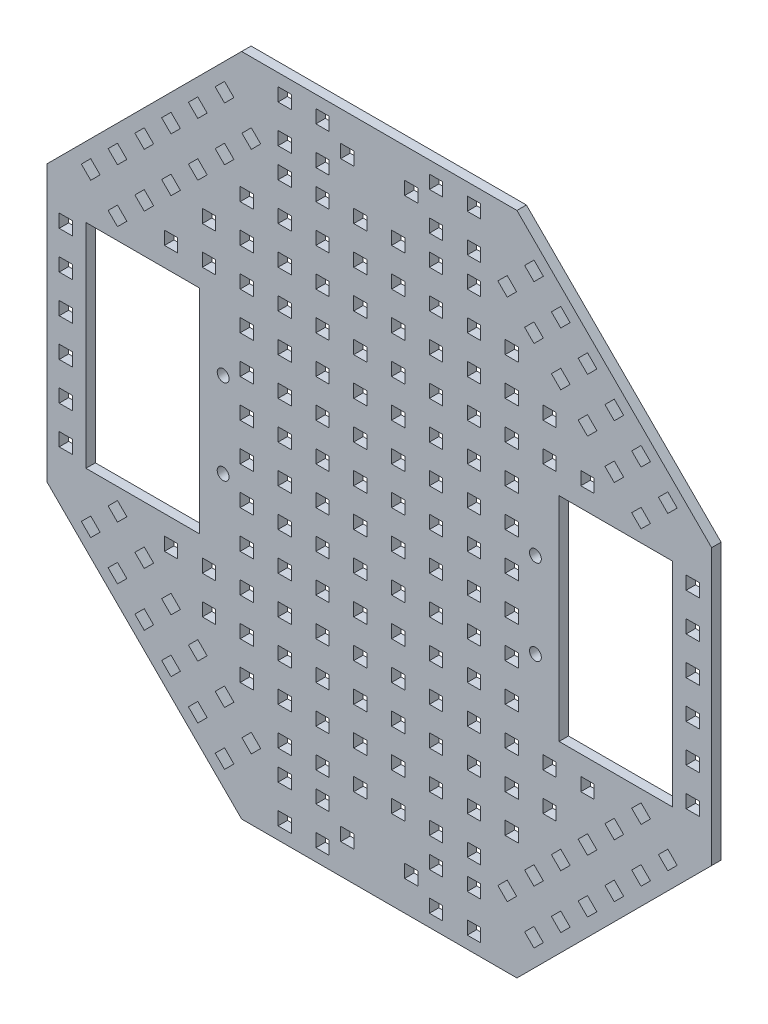
from build123d import *

# Parameters (mm, degrees)
ESBO_O4_R                = 1.249999059
ESBO_O4_R_2              = 1.250001584
ESBO_O4_W                = 2.8
ESBO_O4_H                = 2.8
RESSALTO_EXTRUS_O1_DEPTH = 2
ESBO_O5_W                = 2.8
ESBO_O5_H                = 2.8
CORTE_EXTRUS_O1_DEPTH    = 100.364031547


with BuildPart() as part:
    # Esboço4 → Ressalto-extrusão1 (new body)
    with BuildSketch(Plane.XY):
        Polygon((29.09715508, 70.246746421), (-29.09715508, 70.246746421), (-70.246746421, 29.09715508), (-70.246746421, -29.09715508), (-29.09715508, -70.246746421), (29.09715508, -70.246746421), (70.246746421, -29.09715508), (70.246746421, 29.09715508), align=None)
        with Locations((-32.999995927, 8.999995245)):
            Circle(ESBO_O4_R, mode=Mode.SUBTRACT)
        with Locations((-32.999995927, -9.000003853)):
            Circle(ESBO_O4_R_2, mode=Mode.SUBTRACT)
        with Locations((32.999995927, -9.000003853)):
            Circle(ESBO_O4_R_2, mode=Mode.SUBTRACT)
        with Locations((32.999995927, 8.999995245)):
            Circle(ESBO_O4_R, mode=Mode.SUBTRACT)
        Polygon((-37.99999547, 0), (-37.99999547, 22.5), (-61.99999547, 22.5), (-61.99999547, -22.5), (-37.99999547, -22.5), align=None, mode=Mode.SUBTRACT)
        with Locations((-6.749998331, -62.499996189)):
            Rectangle(ESBO_O4_W, ESBO_O4_H, mode=Mode.SUBTRACT)
        with Locations((-6.749998331, 62.499996189)):
            Rectangle(ESBO_O4_W, ESBO_O4_H, mode=Mode.SUBTRACT)
        with Locations((6.749998331, -62.499996189)):
            Rectangle(ESBO_O4_W, ESBO_O4_H, mode=Mode.SUBTRACT)
        with Locations((6.749998331, 62.499996189)):
            Rectangle(ESBO_O4_W, ESBO_O4_H, mode=Mode.SUBTRACT)
        Polygon((37.99999547, -22.5), (37.99999547, 0), (37.99999547, 22.5), (61.99999547, 22.5), (61.99999547, -22.5), align=None, mode=Mode.SUBTRACT)
    extrude(amount=RESSALTO_EXTRUS_O1_DEPTH)

    # Esboço5 → Corte-extrusão1 (cut, through all)
    with BuildSketch(Plane(origin=(0, 0, 0), x_dir=(-1, 0, 0), z_dir=(0, 0, -1))):
        with Locations((-12, -4)):
            Rectangle(ESBO_O5_W, ESBO_O5_H)
        with Locations((-4, -4)):
            Rectangle(ESBO_O5_W, ESBO_O5_H)
        with Locations((-20, -4)):
            Rectangle(ESBO_O5_W, ESBO_O5_H)
        with Locations((-28, -4)):
            Rectangle(ESBO_O5_W, ESBO_O5_H)
        with Locations((-12, -12)):
            Rectangle(ESBO_O5_W, ESBO_O5_H)
        with Locations((-20, -12)):
            Rectangle(ESBO_O5_W, ESBO_O5_H)
        with Locations((-28, -12)):
            Rectangle(ESBO_O5_W, ESBO_O5_H)
        with Locations((-12, -20)):
            Rectangle(ESBO_O5_W, ESBO_O5_H)
        with Locations((-20, -20)):
            Rectangle(ESBO_O5_W, ESBO_O5_H)
        with Locations((-28, -20)):
            Rectangle(ESBO_O5_W, ESBO_O5_H)
        with Locations((-12, -28)):
            Rectangle(ESBO_O5_W, ESBO_O5_H)
        with Locations((-20, -28)):
            Rectangle(ESBO_O5_W, ESBO_O5_H)
        with Locations((-28, -28)):
            Rectangle(ESBO_O5_W, ESBO_O5_H)
        with Locations((-36, -28)):
            Rectangle(ESBO_O5_W, ESBO_O5_H)
        with Locations((-44, -28)):
            Rectangle(ESBO_O5_W, ESBO_O5_H)
        with Locations((-12, -36)):
            Rectangle(ESBO_O5_W, ESBO_O5_H)
        with Locations((-20, -36)):
            Rectangle(ESBO_O5_W, ESBO_O5_H)
        with Locations((-28, -36)):
            Rectangle(ESBO_O5_W, ESBO_O5_H)
        with Locations((-36, -36)):
            Rectangle(ESBO_O5_W, ESBO_O5_H)
        with Locations((-12, -44)):
            Rectangle(ESBO_O5_W, ESBO_O5_H)
        with Locations((-20, -44)):
            Rectangle(ESBO_O5_W, ESBO_O5_H)
        with Locations((-28, -44)):
            Rectangle(ESBO_O5_W, ESBO_O5_H)
        with Locations((-12, -52)):
            Rectangle(ESBO_O5_W, ESBO_O5_H)
        with Locations((-20, -52)):
            Rectangle(ESBO_O5_W, ESBO_O5_H)
        with Locations((-4, -12)):
            Rectangle(ESBO_O5_W, ESBO_O5_H)
        with Locations((-4, -20)):
            Rectangle(ESBO_O5_W, ESBO_O5_H)
        with Locations((-4, -28)):
            Rectangle(ESBO_O5_W, ESBO_O5_H)
        with Locations((-4, -36)):
            Rectangle(ESBO_O5_W, ESBO_O5_H)
        with Locations((-4, -44)):
            Rectangle(ESBO_O5_W, ESBO_O5_H)
        with Locations((-4, -52)):
            Rectangle(ESBO_O5_W, ESBO_O5_H)
        with Locations((4, -52)):
            Rectangle(ESBO_O5_W, ESBO_O5_H)
        with Locations((4, -44)):
            Rectangle(ESBO_O5_W, ESBO_O5_H)
        with Locations((4, -36)):
            Rectangle(ESBO_O5_W, ESBO_O5_H)
        with Locations((4, -28)):
            Rectangle(ESBO_O5_W, ESBO_O5_H)
        with Locations((4, -20)):
            Rectangle(ESBO_O5_W, ESBO_O5_H)
        with Locations((4, -12)):
            Rectangle(ESBO_O5_W, ESBO_O5_H)
        with Locations((20, -52)):
            Rectangle(ESBO_O5_W, ESBO_O5_H)
        with Locations((12, -52)):
            Rectangle(ESBO_O5_W, ESBO_O5_H)
        with Locations((28, -44)):
            Rectangle(ESBO_O5_W, ESBO_O5_H)
        with Locations((20, -44)):
            Rectangle(ESBO_O5_W, ESBO_O5_H)
        with Locations((12, -44)):
            Rectangle(ESBO_O5_W, ESBO_O5_H)
        with Locations((36, -36)):
            Rectangle(ESBO_O5_W, ESBO_O5_H)
        with Locations((28, -36)):
            Rectangle(ESBO_O5_W, ESBO_O5_H)
        with Locations((20, -36)):
            Rectangle(ESBO_O5_W, ESBO_O5_H)
        with Locations((12, -36)):
            Rectangle(ESBO_O5_W, ESBO_O5_H)
        with Locations((44, -28)):
            Rectangle(ESBO_O5_W, ESBO_O5_H)
        with Locations((36, -28)):
            Rectangle(ESBO_O5_W, ESBO_O5_H)
        with Locations((28, -28)):
            Rectangle(ESBO_O5_W, ESBO_O5_H)
        with Locations((20, -28)):
            Rectangle(ESBO_O5_W, ESBO_O5_H)
        with Locations((12, -28)):
            Rectangle(ESBO_O5_W, ESBO_O5_H)
        with Locations((28, -20)):
            Rectangle(ESBO_O5_W, ESBO_O5_H)
        with Locations((20, -20)):
            Rectangle(ESBO_O5_W, ESBO_O5_H)
        with Locations((12, -20)):
            Rectangle(ESBO_O5_W, ESBO_O5_H)
        with Locations((28, -12)):
            Rectangle(ESBO_O5_W, ESBO_O5_H)
        with Locations((20, -12)):
            Rectangle(ESBO_O5_W, ESBO_O5_H)
        with Locations((12, -12)):
            Rectangle(ESBO_O5_W, ESBO_O5_H)
        with Locations((28, -4)):
            Rectangle(ESBO_O5_W, ESBO_O5_H)
        with Locations((20, -4)):
            Rectangle(ESBO_O5_W, ESBO_O5_H)
        with Locations((12, -4)):
            Rectangle(ESBO_O5_W, ESBO_O5_H)
        with Locations((4, -4)):
            Rectangle(ESBO_O5_W, ESBO_O5_H)
        with Locations((12, 4)):
            Rectangle(ESBO_O5_W, ESBO_O5_H)
        with Locations((4, 4)):
            Rectangle(ESBO_O5_W, ESBO_O5_H)
        with Locations((20, 4)):
            Rectangle(ESBO_O5_W, ESBO_O5_H)
        with Locations((28, 4)):
            Rectangle(ESBO_O5_W, ESBO_O5_H)
        with Locations((12, 12)):
            Rectangle(ESBO_O5_W, ESBO_O5_H)
        with Locations((20, 12)):
            Rectangle(ESBO_O5_W, ESBO_O5_H)
        with Locations((28, 12)):
            Rectangle(ESBO_O5_W, ESBO_O5_H)
        with Locations((12, 20)):
            Rectangle(ESBO_O5_W, ESBO_O5_H)
        with Locations((20, 20)):
            Rectangle(ESBO_O5_W, ESBO_O5_H)
        with Locations((28, 20)):
            Rectangle(ESBO_O5_W, ESBO_O5_H)
        with Locations((12, 28)):
            Rectangle(ESBO_O5_W, ESBO_O5_H)
        with Locations((20, 28)):
            Rectangle(ESBO_O5_W, ESBO_O5_H)
        with Locations((28, 28)):
            Rectangle(ESBO_O5_W, ESBO_O5_H)
        with Locations((36, 28)):
            Rectangle(ESBO_O5_W, ESBO_O5_H)
        with Locations((44, 28)):
            Rectangle(ESBO_O5_W, ESBO_O5_H)
        with Locations((12, 36)):
            Rectangle(ESBO_O5_W, ESBO_O5_H)
        with Locations((20, 36)):
            Rectangle(ESBO_O5_W, ESBO_O5_H)
        with Locations((28, 36)):
            Rectangle(ESBO_O5_W, ESBO_O5_H)
        with Locations((36, 36)):
            Rectangle(ESBO_O5_W, ESBO_O5_H)
        with Locations((12, 44)):
            Rectangle(ESBO_O5_W, ESBO_O5_H)
        with Locations((20, 44)):
            Rectangle(ESBO_O5_W, ESBO_O5_H)
        with Locations((28, 44)):
            Rectangle(ESBO_O5_W, ESBO_O5_H)
        with Locations((12, 52)):
            Rectangle(ESBO_O5_W, ESBO_O5_H)
        with Locations((20, 52)):
            Rectangle(ESBO_O5_W, ESBO_O5_H)
        with Locations((4, 12)):
            Rectangle(ESBO_O5_W, ESBO_O5_H)
        with Locations((4, 20)):
            Rectangle(ESBO_O5_W, ESBO_O5_H)
        with Locations((4, 28)):
            Rectangle(ESBO_O5_W, ESBO_O5_H)
        with Locations((4, 36)):
            Rectangle(ESBO_O5_W, ESBO_O5_H)
        with Locations((4, 44)):
            Rectangle(ESBO_O5_W, ESBO_O5_H)
        with Locations((4, 52)):
            Rectangle(ESBO_O5_W, ESBO_O5_H)
        with Locations((-4, 52)):
            Rectangle(ESBO_O5_W, ESBO_O5_H)
        with Locations((-4, 44)):
            Rectangle(ESBO_O5_W, ESBO_O5_H)
        with Locations((-4, 36)):
            Rectangle(ESBO_O5_W, ESBO_O5_H)
        with Locations((-4, 28)):
            Rectangle(ESBO_O5_W, ESBO_O5_H)
        with Locations((-4, 20)):
            Rectangle(ESBO_O5_W, ESBO_O5_H)
        with Locations((-4, 12)):
            Rectangle(ESBO_O5_W, ESBO_O5_H)
        with Locations((-20, 52)):
            Rectangle(ESBO_O5_W, ESBO_O5_H)
        with Locations((-12, 52)):
            Rectangle(ESBO_O5_W, ESBO_O5_H)
        with Locations((-28, 44)):
            Rectangle(ESBO_O5_W, ESBO_O5_H)
        with Locations((-20, 44)):
            Rectangle(ESBO_O5_W, ESBO_O5_H)
        with Locations((-12, 44)):
            Rectangle(ESBO_O5_W, ESBO_O5_H)
        with Locations((-36, 36)):
            Rectangle(ESBO_O5_W, ESBO_O5_H)
        with Locations((-28, 36)):
            Rectangle(ESBO_O5_W, ESBO_O5_H)
        with Locations((-20, 36)):
            Rectangle(ESBO_O5_W, ESBO_O5_H)
        with Locations((-12, 36)):
            Rectangle(ESBO_O5_W, ESBO_O5_H)
        with Locations((-44, 28)):
            Rectangle(ESBO_O5_W, ESBO_O5_H)
        with Locations((-36, 28)):
            Rectangle(ESBO_O5_W, ESBO_O5_H)
        with Locations((-28, 28)):
            Rectangle(ESBO_O5_W, ESBO_O5_H)
        with Locations((-20, 28)):
            Rectangle(ESBO_O5_W, ESBO_O5_H)
        with Locations((-12, 28)):
            Rectangle(ESBO_O5_W, ESBO_O5_H)
        with Locations((-28, 20)):
            Rectangle(ESBO_O5_W, ESBO_O5_H)
        with Locations((-20, 20)):
            Rectangle(ESBO_O5_W, ESBO_O5_H)
        with Locations((-12, 20)):
            Rectangle(ESBO_O5_W, ESBO_O5_H)
        with Locations((-28, 12)):
            Rectangle(ESBO_O5_W, ESBO_O5_H)
        with Locations((-20, 12)):
            Rectangle(ESBO_O5_W, ESBO_O5_H)
        with Locations((-12, 12)):
            Rectangle(ESBO_O5_W, ESBO_O5_H)
        with Locations((-28, 4)):
            Rectangle(ESBO_O5_W, ESBO_O5_H)
        with Locations((-20, 4)):
            Rectangle(ESBO_O5_W, ESBO_O5_H)
        with Locations((-12, 4)):
            Rectangle(ESBO_O5_W, ESBO_O5_H)
        with Locations((-4, 4)):
            Rectangle(ESBO_O5_W, ESBO_O5_H)
        with Locations((-12, -66.246746421)):
            Rectangle(ESBO_O5_W, ESBO_O5_H)
        with Locations((-20, -66.246746421)):
            Rectangle(ESBO_O5_W, ESBO_O5_H)
        with Locations((-12, -58.246746421)):
            Rectangle(ESBO_O5_W, ESBO_O5_H)
        with Locations((-20, -58.246746421)):
            Rectangle(ESBO_O5_W, ESBO_O5_H)
        with Locations((20, -58.246746421)):
            Rectangle(ESBO_O5_W, ESBO_O5_H)
        with Locations((12, -58.246746421)):
            Rectangle(ESBO_O5_W, ESBO_O5_H)
        with Locations((20, -66.246746421)):
            Rectangle(ESBO_O5_W, ESBO_O5_H)
        with Locations((12, -66.246746421)):
            Rectangle(ESBO_O5_W, ESBO_O5_H)
        Polygon((-55.328805, -40.338141239), (-57.308703987, -38.358242251), (-55.328805, -36.378343264), (-53.348906012, -38.358242251), align=None)
        Polygon((-49.67195075, -45.994995488), (-51.651849738, -44.015096501), (-49.67195075, -42.035197513), (-47.692051763, -44.015096501), align=None)
        Polygon((-60.985659249, -34.681286989), (-62.965558237, -32.701388002), (-60.985659249, -30.721489014), (-59.005760262, -32.701388002), align=None)
        Polygon((-49.67195075, -34.681286989), (-51.651849738, -32.701388002), (-49.67195075, -30.721489014), (-47.692051763, -32.701388002), align=None)
        Polygon((-55.328805, -29.02443274), (-57.308703987, -27.044533752), (-55.328805, -25.064634765), (-53.348906012, -27.044533752), align=None)
        Polygon((-44.015096501, -40.338141239), (-45.994995488, -38.358242251), (-44.015096501, -36.378343264), (-42.035197513, -38.358242251), align=None)
        Polygon((-38.358242251, -45.994995488), (-36.378343264, -44.015096501), (-38.358242251, -42.035197513), (-40.338141239, -44.015096501), align=None)
        Polygon((-27.044533752, -57.308703987), (-25.064634765, -55.328805), (-27.044533752, -53.348906012), (-29.02443274, -55.328805), align=None)
        Polygon((-32.701388002, -51.651849738), (-30.721489014, -49.67195075), (-32.701388002, -47.692051763), (-34.681286989, -49.67195075), align=None)
        Polygon((-32.701388002, -62.965558237), (-30.721489014, -60.985659249), (-32.701388002, -59.005760262), (-34.681286989, -60.985659249), align=None)
        Polygon((-38.358242251, -57.308703987), (-36.378343264, -55.328805), (-38.358242251, -53.348906012), (-40.338141239, -55.328805), align=None)
        Polygon((-44.015096501, -51.651849738), (-42.035197513, -49.67195075), (-44.015096501, -47.692051763), (-45.994995488, -49.67195075), align=None)
        with Locations((-66.246746421, 12)):
            Rectangle(ESBO_O5_W, ESBO_O5_H)
        with Locations((-66.246746421, 4)):
            Rectangle(ESBO_O5_W, ESBO_O5_H)
        with Locations((-66.246746421, 20)):
            Rectangle(ESBO_O5_W, ESBO_O5_H)
        with Locations((-66.246746421, -20)):
            Rectangle(ESBO_O5_W, ESBO_O5_H)
        with Locations((-66.246746421, -12)):
            Rectangle(ESBO_O5_W, ESBO_O5_H)
        with Locations((-66.246746421, -4)):
            Rectangle(ESBO_O5_W, ESBO_O5_H)
        Polygon((-40.338141239, 55.328805), (-38.358242251, 57.308703987), (-36.378343264, 55.328805), (-38.358242251, 53.348906012), align=None)
        Polygon((-45.994995488, 49.67195075), (-44.015096501, 51.651849738), (-42.035197513, 49.67195075), (-44.015096501, 47.692051763), align=None)
        Polygon((-34.681286989, 60.985659249), (-32.701388002, 62.965558237), (-30.721489014, 60.985659249), (-32.701388002, 59.005760262), align=None)
        Polygon((-34.681286989, 49.67195075), (-32.701388002, 51.651849738), (-30.721489014, 49.67195075), (-32.701388002, 47.692051763), align=None)
        Polygon((-29.02443274, 55.328805), (-27.044533752, 57.308703987), (-25.064634765, 55.328805), (-27.044533752, 53.348906012), align=None)
        Polygon((-40.338141239, 44.015096501), (-38.358242251, 45.994995488), (-36.378343264, 44.015096501), (-38.358242251, 42.035197513), align=None)
        Polygon((-45.994995488, 38.358242251), (-44.015096501, 36.378343264), (-42.035197513, 38.358242251), (-44.015096501, 40.338141239), align=None)
        Polygon((-57.308703987, 27.044533752), (-55.328805, 25.064634765), (-53.348906012, 27.044533752), (-55.328805, 29.02443274), align=None)
        Polygon((-51.651849738, 32.701388002), (-49.67195075, 30.721489014), (-47.692051763, 32.701388002), (-49.67195075, 34.681286989), align=None)
        Polygon((-62.965558237, 32.701388002), (-60.985659249, 30.721489014), (-59.005760262, 32.701388002), (-60.985659249, 34.681286989), align=None)
        Polygon((-57.308703987, 38.358242251), (-55.328805, 36.378343264), (-53.348906012, 38.358242251), (-55.328805, 40.338141239), align=None)
        Polygon((-51.651849738, 44.015096501), (-49.67195075, 42.035197513), (-47.692051763, 44.015096501), (-49.67195075, 45.994995488), align=None)
        with Locations((12, 66.246746421)):
            Rectangle(ESBO_O5_W, ESBO_O5_H)
        with Locations((20, 66.246746421)):
            Rectangle(ESBO_O5_W, ESBO_O5_H)
        with Locations((12, 58.246746421)):
            Rectangle(ESBO_O5_W, ESBO_O5_H)
        with Locations((20, 58.246746421)):
            Rectangle(ESBO_O5_W, ESBO_O5_H)
        with Locations((-20, 58.246746421)):
            Rectangle(ESBO_O5_W, ESBO_O5_H)
        with Locations((-12, 58.246746421)):
            Rectangle(ESBO_O5_W, ESBO_O5_H)
        with Locations((-20, 66.246746421)):
            Rectangle(ESBO_O5_W, ESBO_O5_H)
        with Locations((-12, 66.246746421)):
            Rectangle(ESBO_O5_W, ESBO_O5_H)
        Polygon((55.328805, 40.338141239), (57.308703987, 38.358242251), (55.328805, 36.378343264), (53.348906012, 38.358242251), align=None)
        Polygon((49.67195075, 45.994995488), (51.651849738, 44.015096501), (49.67195075, 42.035197513), (47.692051763, 44.015096501), align=None)
        Polygon((60.985659249, 34.681286989), (62.965558237, 32.701388002), (60.985659249, 30.721489014), (59.005760262, 32.701388002), align=None)
        Polygon((49.67195075, 34.681286989), (51.651849738, 32.701388002), (49.67195075, 30.721489014), (47.692051763, 32.701388002), align=None)
        Polygon((55.328805, 29.02443274), (57.308703987, 27.044533752), (55.328805, 25.064634765), (53.348906012, 27.044533752), align=None)
        Polygon((44.015096501, 40.338141239), (45.994995488, 38.358242251), (44.015096501, 36.378343264), (42.035197513, 38.358242251), align=None)
        Polygon((38.358242251, 45.994995488), (36.378343264, 44.015096501), (38.358242251, 42.035197513), (40.338141239, 44.015096501), align=None)
        Polygon((27.044533752, 57.308703987), (25.064634765, 55.328805), (27.044533752, 53.348906012), (29.02443274, 55.328805), align=None)
        Polygon((32.701388002, 51.651849738), (30.721489014, 49.67195075), (32.701388002, 47.692051763), (34.681286989, 49.67195075), align=None)
        Polygon((32.701388002, 62.965558237), (30.721489014, 60.985659249), (32.701388002, 59.005760262), (34.681286989, 60.985659249), align=None)
        Polygon((38.358242251, 57.308703987), (36.378343264, 55.328805), (38.358242251, 53.348906012), (40.338141239, 55.328805), align=None)
        Polygon((44.015096501, 51.651849738), (42.035197513, 49.67195075), (44.015096501, 47.692051763), (45.994995488, 49.67195075), align=None)
        with Locations((66.246746421, -12)):
            Rectangle(ESBO_O5_W, ESBO_O5_H)
        with Locations((66.246746421, -4)):
            Rectangle(ESBO_O5_W, ESBO_O5_H)
        with Locations((66.246746421, -20)):
            Rectangle(ESBO_O5_W, ESBO_O5_H)
        with Locations((66.246746421, 20)):
            Rectangle(ESBO_O5_W, ESBO_O5_H)
        with Locations((66.246746421, 12)):
            Rectangle(ESBO_O5_W, ESBO_O5_H)
        with Locations((66.246746421, 4)):
            Rectangle(ESBO_O5_W, ESBO_O5_H)
        Polygon((40.338141239, -55.328805), (38.358242251, -57.308703987), (36.378343264, -55.328805), (38.358242251, -53.348906012), align=None)
        Polygon((45.994995488, -49.67195075), (44.015096501, -51.651849738), (42.035197513, -49.67195075), (44.015096501, -47.692051763), align=None)
        Polygon((34.681286989, -60.985659249), (32.701388002, -62.965558237), (30.721489014, -60.985659249), (32.701388002, -59.005760262), align=None)
        Polygon((34.681286989, -49.67195075), (32.701388002, -51.651849738), (30.721489014, -49.67195075), (32.701388002, -47.692051763), align=None)
        Polygon((29.02443274, -55.328805), (27.044533752, -57.308703987), (25.064634765, -55.328805), (27.044533752, -53.348906012), align=None)
        Polygon((40.338141239, -44.015096501), (38.358242251, -45.994995488), (36.378343264, -44.015096501), (38.358242251, -42.035197513), align=None)
        Polygon((45.994995488, -38.358242251), (44.015096501, -36.378343264), (42.035197513, -38.358242251), (44.015096501, -40.338141239), align=None)
        Polygon((57.308703987, -27.044533752), (55.328805, -25.064634765), (53.348906012, -27.044533752), (55.328805, -29.02443274), align=None)
        Polygon((51.651849738, -32.701388002), (49.67195075, -30.721489014), (47.692051763, -32.701388002), (49.67195075, -34.681286989), align=None)
        Polygon((62.965558237, -32.701388002), (60.985659249, -30.721489014), (59.005760262, -32.701388002), (60.985659249, -34.681286989), align=None)
        Polygon((57.308703987, -38.358242251), (55.328805, -36.378343264), (53.348906012, -38.358242251), (55.328805, -40.338141239), align=None)
        Polygon((51.651849738, -44.015096501), (49.67195075, -42.035197513), (47.692051763, -44.015096501), (49.67195075, -45.994995488), align=None)
    extrude(amount=-CORTE_EXTRUS_O1_DEPTH, mode=Mode.SUBTRACT)


solid = part.part
